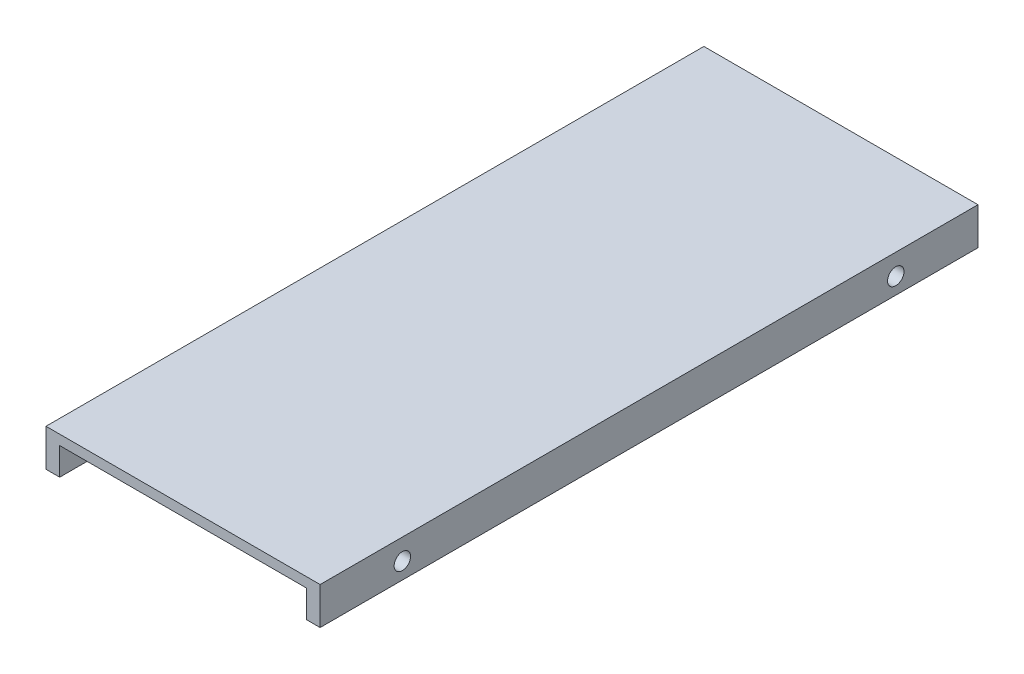
from build123d import *

# Parameters (mm, degrees)
BOSS_EXTRUDE1_DEPTH     = 1200
CUT_EXTRUDE1_DEPTH      = 1301.961183126
CUT_EXTRUDE1_DEPTH_BACK = 1301.961183126
SKETCH2_R               = 15


with BuildPart() as part:
    # Sketch1 → Boss-Extrude1 (new body)
    with BuildSketch(Plane.XY):
        Polygon((0, 18), (0, -50), (25, -50), (25, 0), (475, 0), (475, -50), (500, -50), (500, 18), align=None)
    extrude(amount=BOSS_EXTRUDE1_DEPTH)

    # Sketch2 → Cut-Extrude1 (cut, two sides: drawn at the far end of the back side and taken through both)
    with BuildSketch(Plane(origin=(500, 0, 0), x_dir=(0, 0, -1), z_dir=(1, 0, 0)).offset(-CUT_EXTRUDE1_DEPTH_BACK)):
        with Locations((-1050, -20)):
            Circle(SKETCH2_R)
        with Locations((-150, -20)):
            Circle(SKETCH2_R)
    extrude(amount=CUT_EXTRUDE1_DEPTH + CUT_EXTRUDE1_DEPTH_BACK, mode=Mode.SUBTRACT)


solid = part.part
